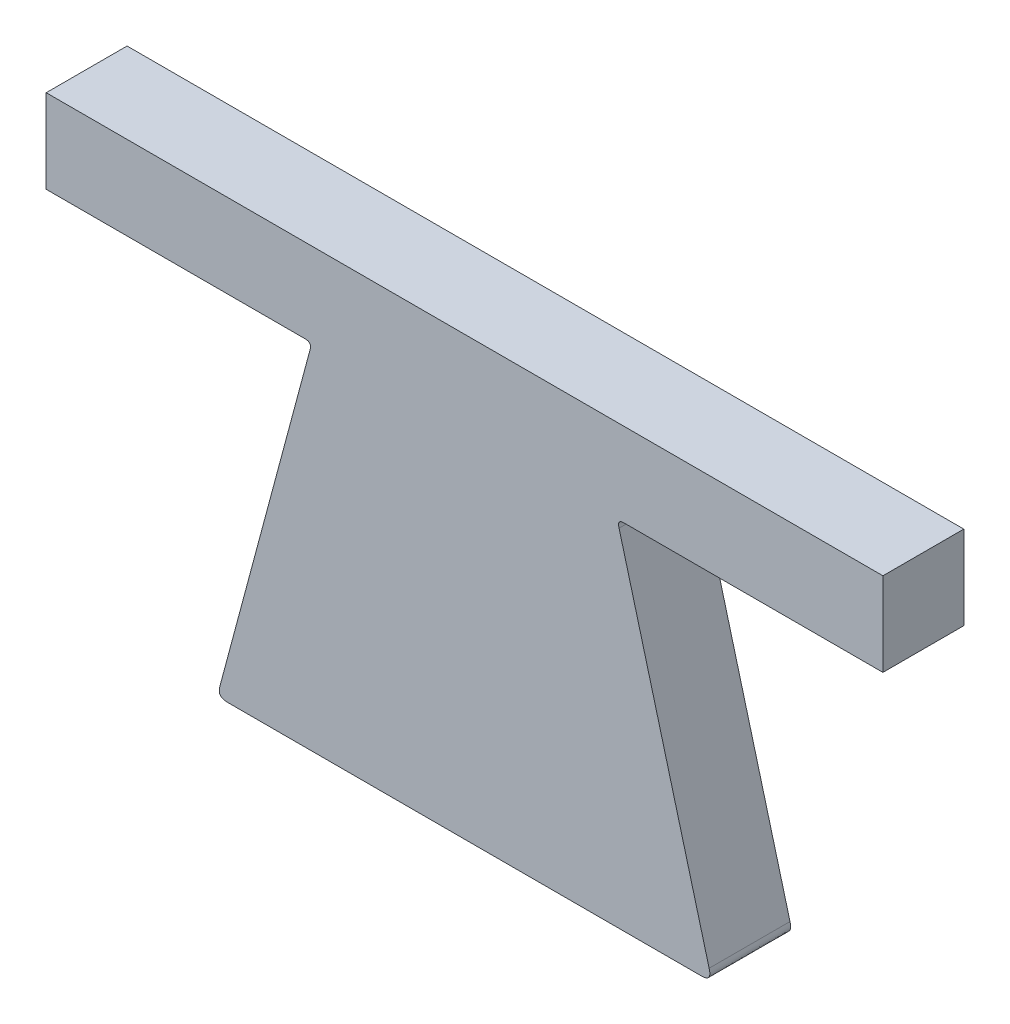
from build123d import *

# Parameters (mm, degrees)
BOSS_EXTRUDE1_DEPTH = 2.9


with BuildPart() as part:
    # Sketch2 → Boss-Extrude1 (new body)
    with BuildSketch(Plane.XY):
        Polygon((6.527918297, 15.78), (3.130322537, 3.1), (20.869677463, 3.1), (17.472081703, 15.78), (27, 15.78), (27, 18.78), (-3, 18.78), (-3, 15.78), align=None)
    extrude(amount=-BOSS_EXTRUDE1_DEPTH)

    # Fillet1
    # a fillet whose section is not a circle: 0.3 mm, written as the material it takes off along each edge
    with BuildSketch(Plane(origin=(3.130322537, 3.1, 0.97741903), x_dir=(0.2588190451025178, 0.9659258262890691, 0), z_dir=(0, 0, -1)), Plane(origin=(20.869677463, 3.1, 0.97741903), x_dir=(-1, 0, 0), z_dir=(0, 0, -1))) as fillet1_piece_1:
        with BuildLine():
            add(Edge.make_bspline([(0.390967612, 0), (0.328357725, 0), (0.265747838, 0), (0.130034743, 0.031807338), (0.064378997, 0.117371571), (0.068780602, 0.2566927), (0.084985233, 0.317169207), (0.101189864, 0.377645714)], knots=[0, 0, 0, 0, 0, 0, 0.5, 0.5, 1, 1, 1, 1, 1, 1], degree=5))
            Line((0.101189864, 0.377645714), (0, 0))
            Line((0, 0), (0.390967612, 0))
        make_face()
    extrude(amount=4.854838059, mode=Mode.SUBTRACT)

    # Fillet2
    # a fillet whose section is not a circle: 0.2 mm, written as the material it adds along each edge
    with BuildSketch(Plane(origin=(6.527918297, 15.78, 0), x_dir=(-0.25881904510252, -0.9659258262890685, 0), z_dir=(0, 0, -1)), Plane(origin=(17.472081703, 15.78, 0), x_dir=(1, 0, 0), z_dir=(0, 0, -1))) as fillet2_piece_1:
        with BuildLine():
            add(Edge.make_bspline([(0.260645075, 0), (0.21890515, 0), (0.177165225, 0), (0.086689828, 0.021204892), (0.042919331, 0.078247714), (0.045853734, 0.171128466), (0.056656822, 0.211446138), (0.067459909, 0.251763809)], knots=[0, 0, 0, 0, 0, 0, 0.5, 0.5, 1, 1, 1, 1, 1, 1], degree=5))
            Line((0.067459909, 0.251763809), (0, 0))
            Line((0, 0), (0.260645075, 0))
        make_face()
    extrude(amount=2.9)


solid = part.part
